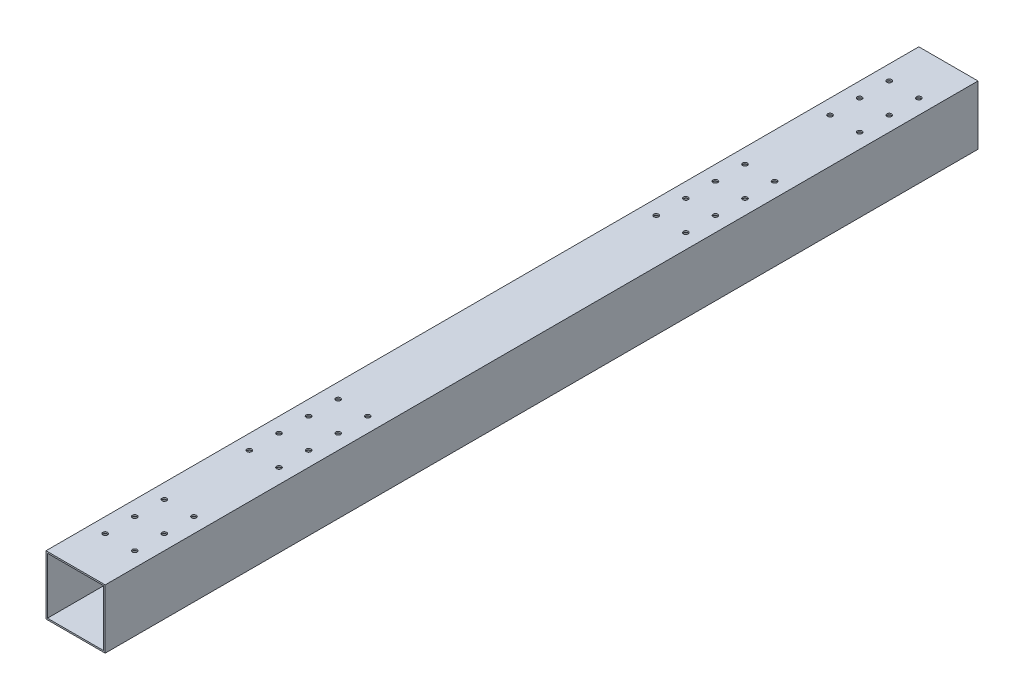
from build123d import *

# Parameters (mm, degrees)
SKETCH_1_W          = 40
SKETCH_1_H          = 40
SKETCH_1_W_2        = 38
SKETCH_1_H_2        = 38
EXTRUDE_1_DEPTH     = 295
SKETCH_2_R          = 1.6
CUT_EXTRUDE_1_DEPTH = 299.370574957
CUT_EXTRUDE_2_REACH = 300.371
SKETCH_3_R          = 1.6


with BuildPart() as part:
    # 草图1 → 凸台-拉伸1 (new, symmetric)
    with BuildSketch(Plane.XY):
        Rectangle(SKETCH_1_W, SKETCH_1_H)
        Rectangle(SKETCH_1_W_2, SKETCH_1_H_2, mode=Mode.SUBTRACT)
    extrude(amount=EXTRUDE_1_DEPTH, both=True)

    # 草图2 → 切除-拉伸1 (cut, through all)
    with BuildSketch(Plane(origin=(0, 20, 0), x_dir=(1, 0, 0), z_dir=(0, 1, 0))):
        with Locations((-10, -167.5)):
            Circle(SKETCH_2_R)
        with Locations((10, -167.5)):
            Circle(SKETCH_2_R)
        with Locations((-10, -147.5)):
            Circle(SKETCH_2_R)
        with Locations((10, -147.5)):
            Circle(SKETCH_2_R)
        with Locations((-10, -127.5)):
            Circle(SKETCH_2_R)
        with Locations((10, -127.5)):
            Circle(SKETCH_2_R)
        with Locations((-10, -107.5)):
            Circle(SKETCH_2_R)
        with Locations((10, -107.5)):
            Circle(SKETCH_2_R)
        with Locations((10, 107.5)):
            Circle(SKETCH_2_R)
        with Locations((-10, 107.5)):
            Circle(SKETCH_2_R)
        with Locations((10, 127.5)):
            Circle(SKETCH_2_R)
        with Locations((-10, 127.5)):
            Circle(SKETCH_2_R)
        with Locations((10, 147.5)):
            Circle(SKETCH_2_R)
        with Locations((-10, 147.5)):
            Circle(SKETCH_2_R)
        with Locations((10, 167.5)):
            Circle(SKETCH_2_R)
        with Locations((-10, 167.5)):
            Circle(SKETCH_2_R)
    extrude(amount=-CUT_EXTRUDE_1_DEPTH, mode=Mode.SUBTRACT)

    # 草图3 → 切除-拉伸2 (cut, up to next)
    with BuildSketch(Plane(origin=(0, 20, 0), x_dir=(1, 0, 0), z_dir=(0, 1, 0)), mode=Mode.PRIVATE) as cut_extrude_2_sk1:
        with Locations((-10, 225)):
            Circle(SKETCH_3_R)
    cut_extrude_2_tool1 = extrude(cut_extrude_2_sk1.sketch, amount=-CUT_EXTRUDE_2_REACH, mode=Mode.PRIVATE) & part.part
    # 草图3 → 切除-拉伸2 (cut, up to next)
    with BuildSketch(Plane(origin=(0, 20, 0), x_dir=(1, 0, 0), z_dir=(0, 1, 0)), mode=Mode.PRIVATE) as cut_extrude_2_sk2:
        with Locations((10, 225)):
            Circle(SKETCH_3_R)
    cut_extrude_2_tool2 = extrude(cut_extrude_2_sk2.sketch, amount=-CUT_EXTRUDE_2_REACH, mode=Mode.PRIVATE) & part.part
    # 草图3 → 切除-拉伸2 (cut, up to next)
    with BuildSketch(Plane(origin=(0, 20, 0), x_dir=(1, 0, 0), z_dir=(0, 1, 0)), mode=Mode.PRIVATE) as cut_extrude_2_sk3:
        with Locations((10, 245)):
            Circle(SKETCH_3_R)
    cut_extrude_2_tool3 = extrude(cut_extrude_2_sk3.sketch, amount=-CUT_EXTRUDE_2_REACH, mode=Mode.PRIVATE) & part.part
    # 草图3 → 切除-拉伸2 (cut, up to next)
    with BuildSketch(Plane(origin=(0, 20, 0), x_dir=(1, 0, 0), z_dir=(0, 1, 0)), mode=Mode.PRIVATE) as cut_extrude_2_sk4:
        with Locations((-10, 245)):
            Circle(SKETCH_3_R)
    cut_extrude_2_tool4 = extrude(cut_extrude_2_sk4.sketch, amount=-CUT_EXTRUDE_2_REACH, mode=Mode.PRIVATE) & part.part
    # 草图3 → 切除-拉伸2 (cut, up to next)
    with BuildSketch(Plane(origin=(0, 20, 0), x_dir=(1, 0, 0), z_dir=(0, 1, 0)), mode=Mode.PRIVATE) as cut_extrude_2_sk5:
        with Locations((-10, 265)):
            Circle(SKETCH_3_R)
    cut_extrude_2_tool5 = extrude(cut_extrude_2_sk5.sketch, amount=-CUT_EXTRUDE_2_REACH, mode=Mode.PRIVATE) & part.part
    # 草图3 → 切除-拉伸2 (cut, up to next)
    with BuildSketch(Plane(origin=(0, 20, 0), x_dir=(1, 0, 0), z_dir=(0, 1, 0)), mode=Mode.PRIVATE) as cut_extrude_2_sk6:
        with Locations((10, 265)):
            Circle(SKETCH_3_R)
    cut_extrude_2_tool6 = extrude(cut_extrude_2_sk6.sketch, amount=-CUT_EXTRUDE_2_REACH, mode=Mode.PRIVATE) & part.part
    # 草图3 → 切除-拉伸2 (cut, up to next)
    with BuildSketch(Plane(origin=(0, 20, 0), x_dir=(1, 0, 0), z_dir=(0, 1, 0)), mode=Mode.PRIVATE) as cut_extrude_2_sk7:
        with Locations((10, -265)):
            Circle(SKETCH_3_R)
    cut_extrude_2_tool7 = extrude(cut_extrude_2_sk7.sketch, amount=-CUT_EXTRUDE_2_REACH, mode=Mode.PRIVATE) & part.part
    # 草图3 → 切除-拉伸2 (cut, up to next)
    with BuildSketch(Plane(origin=(0, 20, 0), x_dir=(1, 0, 0), z_dir=(0, 1, 0)), mode=Mode.PRIVATE) as cut_extrude_2_sk8:
        with Locations((-10, -265)):
            Circle(SKETCH_3_R)
    cut_extrude_2_tool8 = extrude(cut_extrude_2_sk8.sketch, amount=-CUT_EXTRUDE_2_REACH, mode=Mode.PRIVATE) & part.part
    # 草图3 → 切除-拉伸2 (cut, up to next)
    with BuildSketch(Plane(origin=(0, 20, 0), x_dir=(1, 0, 0), z_dir=(0, 1, 0)), mode=Mode.PRIVATE) as cut_extrude_2_sk9:
        with Locations((-10, -245)):
            Circle(SKETCH_3_R)
    cut_extrude_2_tool9 = extrude(cut_extrude_2_sk9.sketch, amount=-CUT_EXTRUDE_2_REACH, mode=Mode.PRIVATE) & part.part
    # 草图3 → 切除-拉伸2 (cut, up to next)
    with BuildSketch(Plane(origin=(0, 20, 0), x_dir=(1, 0, 0), z_dir=(0, 1, 0)), mode=Mode.PRIVATE) as cut_extrude_2_sk10:
        with Locations((10, -245)):
            Circle(SKETCH_3_R)
    cut_extrude_2_tool10 = extrude(cut_extrude_2_sk10.sketch, amount=-CUT_EXTRUDE_2_REACH, mode=Mode.PRIVATE) & part.part
    # 草图3 → 切除-拉伸2 (cut, up to next)
    with BuildSketch(Plane(origin=(0, 20, 0), x_dir=(1, 0, 0), z_dir=(0, 1, 0)), mode=Mode.PRIVATE) as cut_extrude_2_sk11:
        with Locations((10, -225)):
            Circle(SKETCH_3_R)
    cut_extrude_2_tool11 = extrude(cut_extrude_2_sk11.sketch, amount=-CUT_EXTRUDE_2_REACH, mode=Mode.PRIVATE) & part.part
    # 草图3 → 切除-拉伸2 (cut, up to next)
    with BuildSketch(Plane(origin=(0, 20, 0), x_dir=(1, 0, 0), z_dir=(0, 1, 0)), mode=Mode.PRIVATE) as cut_extrude_2_sk12:
        with Locations((-10, -225)):
            Circle(SKETCH_3_R)
    cut_extrude_2_tool12 = extrude(cut_extrude_2_sk12.sketch, amount=-CUT_EXTRUDE_2_REACH, mode=Mode.PRIVATE) & part.part
    add(cut_extrude_2_tool1.solids().sort_by_distance((-10, 20, -225))[0], mode=Mode.SUBTRACT)
    add(cut_extrude_2_tool2.solids().sort_by_distance((10, 20, -225))[0], mode=Mode.SUBTRACT)
    add(cut_extrude_2_tool3.solids().sort_by_distance((10, 20, -245))[0], mode=Mode.SUBTRACT)
    add(cut_extrude_2_tool4.solids().sort_by_distance((-10, 20, -245))[0], mode=Mode.SUBTRACT)
    add(cut_extrude_2_tool5.solids().sort_by_distance((-10, 20, -265))[0], mode=Mode.SUBTRACT)
    add(cut_extrude_2_tool6.solids().sort_by_distance((10, 20, -265))[0], mode=Mode.SUBTRACT)
    add(cut_extrude_2_tool7.solids().sort_by_distance((10, 20, 265))[0], mode=Mode.SUBTRACT)
    add(cut_extrude_2_tool8.solids().sort_by_distance((-10, 20, 265))[0], mode=Mode.SUBTRACT)
    add(cut_extrude_2_tool9.solids().sort_by_distance((-10, 20, 245))[0], mode=Mode.SUBTRACT)
    add(cut_extrude_2_tool10.solids().sort_by_distance((10, 20, 245))[0], mode=Mode.SUBTRACT)
    add(cut_extrude_2_tool11.solids().sort_by_distance((10, 20, 225))[0], mode=Mode.SUBTRACT)
    add(cut_extrude_2_tool12.solids().sort_by_distance((-10, 20, 225))[0], mode=Mode.SUBTRACT)


solid = part.part
